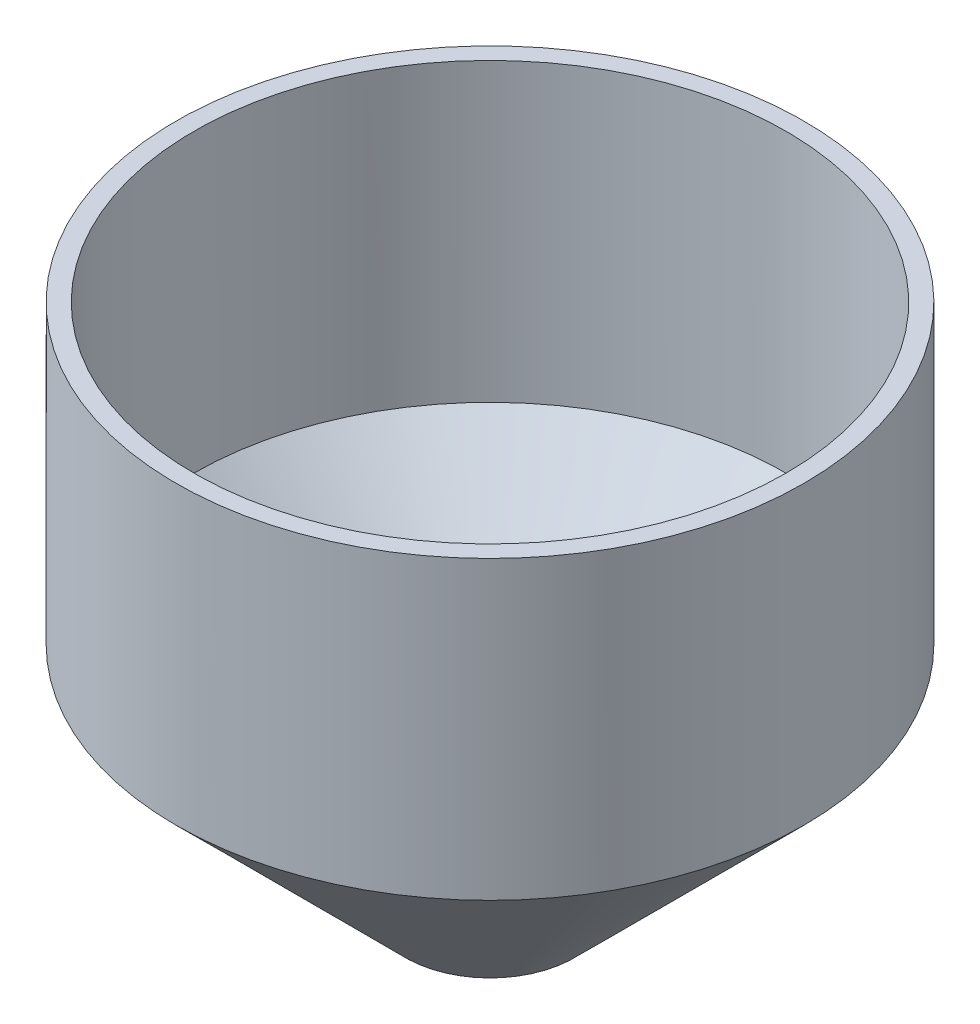
from build123d import *


with BuildPart() as part:
    # Sketch2 → Revolve2 (revolve)
    with BuildSketch(Plane.XY):
        Polygon((21.2, 20), (21.2, 0), (5.7, -15.5), (4.5, -15.5), (20, 0), (20, 20), align=None)
    revolve(axis=Axis((0, -1000, 0), (0, 1, 0)))


solid = part.part
